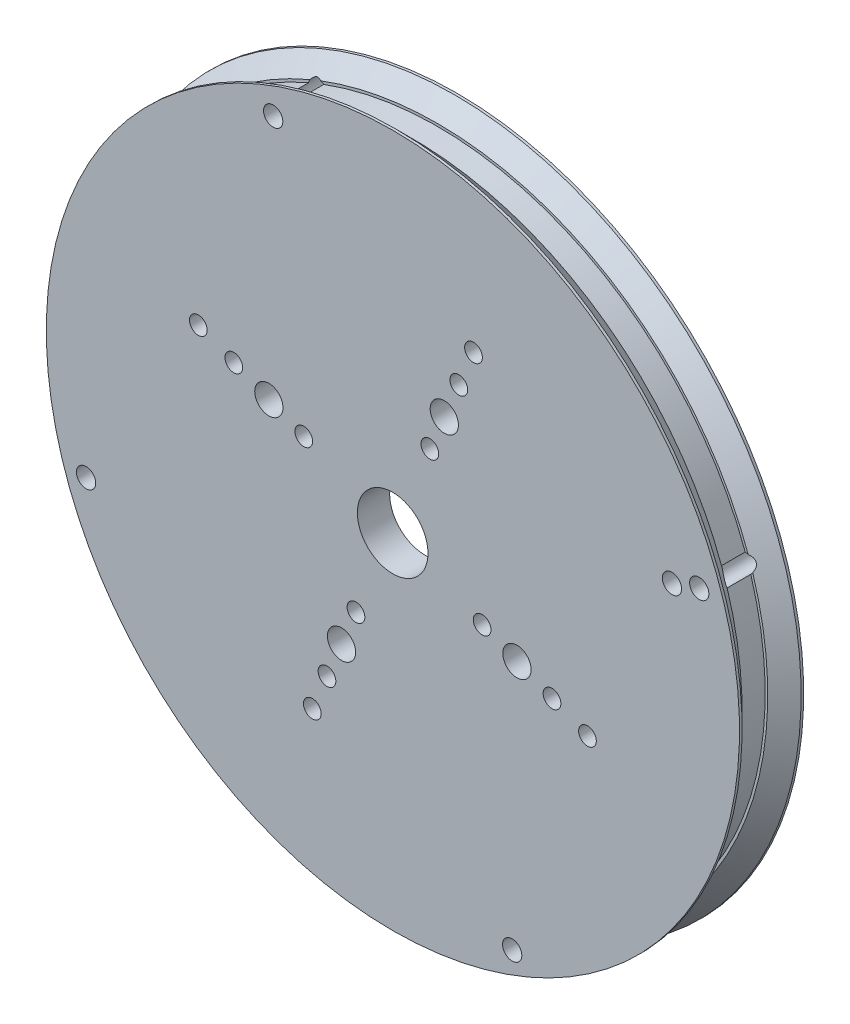
from build123d import *

# Parameters (mm, degrees)
ESQUISSE1_W             = 2
ESQUISSE1_H             = 25.5
ESQUISSE2_R             = 2.75
ENL_V_MAT_EXTRU_1_DEPTH = 10
ESQUISSE13_R            = 0.689564765
ESQUISSE13_R_2          = 1.1
ENL_V_MAT_EXTRU_4_DEPTH = 10
ENL_V_MAT_EXTRU_5_DEPTH = 2.5
ESQUISSE15_R            = 0.75
ENL_V_MAT_EXTRU_6_DEPTH = 6
CHANFREIN1_SIZE         = 1.3


with BuildPart() as part:
    # Esquisse1 → Révolution1 (revolve)
    with BuildSketch(Plane(origin=(0, 0, 1.686606393), x_dir=(0, 0, -1), z_dir=(1, 0, 0))):
        with Locations((-0.82862688, 9.75)):
            Rectangle(ESQUISSE1_W, ESQUISSE1_H)
        Polygon((0.17137312, 22.5), (0.17137312, -3), (1.67137312, -3), (1.67137312, 24), (0.17137312, 24), align=None)
        Polygon((-3.32862688, -3), (-1.82862688, -3), (-1.82862688, 22.5), (-1.82862688, 24), (-3.32862688, 24), align=None)
    revolve(axis=Axis((0, -3, 1.515233274), (0, 0, 1)))

    # Esquisse2 → Enlèv. mat.-Extru.1 (cut)
    with BuildSketch(Plane.XY.offset(5.015233274)):
        with Locations((-0.018231274, -3.175370846)):
            Circle(ESQUISSE2_R)
    extrude(amount=-ENL_V_MAT_EXTRU_1_DEPTH, mode=Mode.SUBTRACT)

    # Esquisse13 → Enlèv. mat.-Extru.4 (cut)
    with BuildSketch(Plane.XY):
        with Locations(Location((-2.877815561, -9.947559111, 0), (0, 0, 90))):
            Circle(ESQUISSE13_R)
        with Locations(Location((6.947559111, -5.877815561, 0), (0, 0, 90))):
            Circle(ESQUISSE13_R)
        with Locations(Location((9.663759082, -7.002918985, 0), (0, 0, 90))):
            Circle(ESQUISSE13_R_2)
        with Locations(Location((12.393817217, -8.133762733, 0), (0, 0, 90))):
            Circle(ESQUISSE13_R)
        with Locations(Location((15.156211065, -9.278000569, 0), (0, 0, 90))):
            Circle(ESQUISSE13_R)
        with Locations(Location((2.877815561, 3.947559111, 0), (0, 0, 90))):
            Circle(ESQUISSE13_R)
        with Locations(Location((4.002918985, 6.663759082, 0), (0, 0, 90))):
            Circle(ESQUISSE13_R_2)
        with Locations(Location((5.133762733, 9.393817217, 0), (0, 0, 90))):
            Circle(ESQUISSE13_R)
        with Locations(Location((6.278000569, 12.156211065, 0), (0, 0, 90))):
            Circle(ESQUISSE13_R)
        with Locations(Location((-4.002918985, -12.663759082, 0), (0, 0, 90))):
            Circle(ESQUISSE13_R_2)
        with Locations(Location((-5.133762733, -15.393817217, 0), (0, 0, 90))):
            Circle(ESQUISSE13_R)
        with Locations(Location((-6.278000569, -18.156211065, 0), (0, 0, 90))):
            Circle(ESQUISSE13_R)
        with Locations(Location((-6.947559111, -0.122184439, 0), (0, 0, 90))):
            Circle(ESQUISSE13_R)
        with Locations(Location((-9.663759082, 1.002918985, 0), (0, 0, 90))):
            Circle(ESQUISSE13_R_2)
        with Locations(Location((-12.393817217, 2.133762733, 0), (0, 0, 90))):
            Circle(ESQUISSE13_R)
        with Locations(Location((-15.156211065, 3.278000569, 0), (0, 0, 90))):
            Circle(ESQUISSE13_R)
    extrude(amount=ENL_V_MAT_EXTRU_4_DEPTH, mode=Mode.SUBTRACT)

    # Esquisse14 → Enlèv. mat.-Extru.5 (cut)
    with BuildSketch(Plane.XY):
        with BuildLine():
            add(Edge.make_bspline(
                [(-0.834521935, 5.736060012), (-1.323561854, 4.206786323), (-2.604336043, 3.206660041), (-4.266586192, 3.071955003), (-5.739527965, 3.849312559)],
                knots=[-0.004811451, -0.004811451, -0.004811451, 0.373998328, 0.62653818, 1.005347959, 1.005347959, 1.005347959], degree=2))
            add(Edge.make_bspline(
                [(-5.739527965, 3.849312559), (-6.215062727, 3.931748239), (-7.18513586, 4.103529144), (-8.521385754, 4.347386976), (-9.8525478, 4.591251504), (-11.213312584, 4.834897157), (-12.421703021, 5.043723017), (-13.451716375, 5.209918112), (-14.279124381, 5.349514694), (-15.176302974, 5.354838403), (-16.01514225, 5.097393355), (-16.715602869, 4.596233984), (-17.154797612, 3.816013645), (-17.246922742, 2.915850366), (-16.972371092, 2.027473332), (-16.334691685, 1.422538372), (-15.722165203, 0.98450718), (-15.160149994, 0.564460476), (-14.444317483, 0.044435179), (-13.597049726, -0.561090872), (-12.573240224, -1.272829231), (-11.465820255, -2.02888463), (-10.398841116, -2.750817016), (-9.434985773, -3.402552324), (-8.881560832, -3.777197572), (-8.613882977, -3.958566886)],
                knots=[-0.001387734, -0.001387734, -0.001387734, -0.001387734, 0.061324894, 0.124037522, 0.18675015, 0.249462779, 0.312175407, 0.343531721, 0.374888035, 0.406244349, 0.437600663, 0.468956977, 0.500313291, 0.531669605, 0.563025919, 0.594382233, 0.625738548, 0.657094862, 0.688451176, 0.751163804, 0.813876432, 0.87658906, 0.939301688, 0.970658002, 1.002014316, 1.002014316, 1.002014316, 1.002014316], degree=3))
            add(Edge.make_bspline(
                [(-8.613882977, -3.958566886), (-7.115175315, -4.428435003), (-6.119086182, -5.654227733), (-5.957704531, -7.233576255), (-6.683427054, -8.639297758)],
                knots=[-0.005464898, -0.005464898, -0.005464898, 0.373559068, 0.626241712, 1.005265678, 1.005265678, 1.005265678], degree=2))
            add(Edge.make_bspline(
                [(-6.683427054, -8.639297758), (-6.736524361, -8.945610043), (-6.846666072, -9.577342021), (-7.042690275, -10.686674514), (-7.265854476, -11.930051113), (-7.506375972, -13.259401813), (-7.733828712, -14.537836364), (-7.926142256, -15.642839645), (-8.081969882, -16.60254416), (-8.217852425, -17.370429264), (-8.286620465, -18.25629548), (-8.064865225, -19.166982635), (-7.595647871, -19.938814159), (-6.805249095, -20.409255683), (-5.902998591, -20.361444051), (-5.05363368, -20.004133612), (-4.348361359, -19.395876796), (-3.700080535, -18.484475185), (-3.020597942, -17.507736588), (-2.269715572, -16.42953922), (-1.542463308, -15.3798635), (-0.772516376, -14.269564041), (-0.039679278, -13.216193215), (0.621403807, -12.269451004), (1.001226307, -11.726951139), (1.185184369, -11.464487256)],
                knots=[-0.001388305, -0.001388305, -0.001388305, -0.001388305, 0.029952258, 0.061292822, 0.123973949, 0.186655076, 0.249336203, 0.31201733, 0.343357894, 0.374698458, 0.406039021, 0.437379585, 0.468720148, 0.500060712, 0.531401276, 0.562741839, 0.594082403, 0.625422966, 0.688104094, 0.750785221, 0.813466348, 0.876147475, 0.938828602, 0.970169166, 1.00150973, 1.00150973, 1.00150973, 1.00150973], degree=3))
            add(Edge.make_bspline(
                [(1.185184369, -11.464487256), (1.65490631, -10.059324715), (2.829358422, -9.15844428), (4.33447116, -9.05073647), (5.670220815, -9.779713653)],
                knots=[-0.006505251, -0.006505251, -0.006505251, 0.373008228, 0.626017214, 1.005530693, 1.005530693, 1.005530693], degree=2))
            add(Edge.make_bspline(
                [(5.670220815, -9.779713653), (6.569459508, -9.916444916), (7.901232109, -10.093165819), (9.759113621, -10.347529942), (11.17252884, -10.561212218), (12.369040829, -10.770551448), (13.339136626, -10.966848112), (14.065124948, -11.124018436), (14.821895835, -11.319046534), (15.70861899, -11.312430159), (16.534204861, -10.936968), (17.182071527, -10.310137698), (17.46484991, -9.429689564), (17.318925746, -8.547107531), (16.868617318, -7.786086578), (16.246601622, -7.307558249), (15.666761077, -6.904515186), (14.884513279, -6.351538957), (13.911192215, -5.672398343), (12.742499913, -4.856303143), (11.187695713, -3.765151227), (10.012709728, -2.923155523), (9.239873833, -2.355364652)],
                knots=[-0.002298263, -0.002298263, -0.002298263, -0.002298263, 0.123303723, 0.186104716, 0.248905709, 0.311706702, 0.343107198, 0.374507695, 0.405908192, 0.437308688, 0.468709185, 0.500109681, 0.531510178, 0.562910674, 0.594311171, 0.625711667, 0.657112164, 0.68851266, 0.751313653, 0.814114646, 0.876915639, 1.002517625, 1.002517625, 1.002517625, 1.002517625], degree=3))
            add(Edge.make_bspline(
                [(9.239873833, -2.355364652), (7.570556122, -1.863499203), (6.434531603, -0.547970888), (6.224755639, 1.141501953), (6.996491401, 2.645273855)],
                knots=[-0.004925251, -0.004925251, -0.004925251, 0.374046612, 0.62669452, 1.005666382, 1.005666382, 1.005666382], degree=2))
            add(Edge.make_bspline(
                [(6.996491401, 2.645273855), (7.027959892, 2.817346112), (7.083924673, 3.148814023), (7.1936659, 3.923344094), (7.32371884, 5.006057526), (7.494019942, 6.463811724), (7.699325151, 8.02176849), (7.917067912, 9.357588835), (8.130539857, 10.427981639), (8.310516379, 11.208029269), (8.52290283, 12.033801752), (8.398362089, 12.962975893), (7.885021118, 13.729666175), (6.856960913, 14.4307326), (5.569353873, 14.314542315), (4.608438514, 13.601362603), (4.146393984, 12.928647397), (3.737616682, 12.315820412), (3.186319926, 11.514298153), (2.511403124, 10.551718459), (1.702996836, 9.416222225), (0.8835841, 8.260635797), (0.05047789, 7.063148514), (-0.546817155, 6.17332486), (-0.834521935, 5.736060012)],
                knots=[-0.001626184, -0.001626184, -0.001626184, -0.001626184, 0.029764798, 0.061155781, 0.123937746, 0.186719712, 0.249501677, 0.312283642, 0.343674625, 0.375065608, 0.40645659, 0.437847573, 0.469238555, 0.500629538, 0.563411503, 0.594802486, 0.626193469, 0.657584451, 0.688975434, 0.751757399, 0.814539365, 0.87732133, 0.940103295, 1.002885261, 1.002885261, 1.002885261, 1.002885261], degree=3))
        make_face()
    extrude(amount=ENL_V_MAT_EXTRU_5_DEPTH, mode=Mode.SUBTRACT)

    # Esquisse15 → Enlèv. mat.-Extru.6 (cut)
    with BuildSketch(Plane(origin=(0, 0, 0.015233274), x_dir=(-1, 0, 0), z_dir=(0, 0, -1))):
        with Locations(Location((-21.73394458, 4.29743623, 0), (0, 0, 90))):
            Circle(ESQUISSE15_R)
        with Locations(Location((23.898337375, -11.379213397, 0), (0, 0, 90))):
            Circle(ESQUISSE15_R)
        with Locations(Location((9.326817375, 20.296159245, 0), (0, 0, 90))):
            Circle(ESQUISSE15_R)
        with Locations(Location((-23.861874827, 5.028471705, 0), (0, 0, 90))):
            Circle(ESQUISSE15_R)
        with Locations(Location((-9.290354827, -26.646900937, 0), (0, 0, 90))):
            Circle(ESQUISSE15_R)
    extrude(amount=-ENL_V_MAT_EXTRU_6_DEPTH, mode=Mode.SUBTRACT)

    # Chanfrein1
    # the kernel refuses this chamfer: 1.3 mm, written as the material it takes off along each edge
    with BuildSketch(Plane(origin=(0, -3, 3.515233274), x_dir=(0, 1, 0), z_dir=(1, 0, 0))) as chanfrein1_piece_1:
        Polygon((27 - CHANFREIN1_SIZE, 0), (27, CHANFREIN1_SIZE), (27, 0), align=None)
    revolve(axis=Axis((0, -3, 3.515233274), (0, 0, 1)), mode=Mode.SUBTRACT)
    with BuildSketch(Plane(origin=(0, -3, 1.515233274), x_dir=(0, 1, 0), z_dir=(1, 0, 0))) as chanfrein1_piece_2:
        Polygon((27 - CHANFREIN1_SIZE, 0), (27, -CHANFREIN1_SIZE), (27, 0), align=None)
    revolve(axis=Axis((0, -3, 1.515233274), (0, 0, 1)), mode=Mode.SUBTRACT)


solid = part.part
